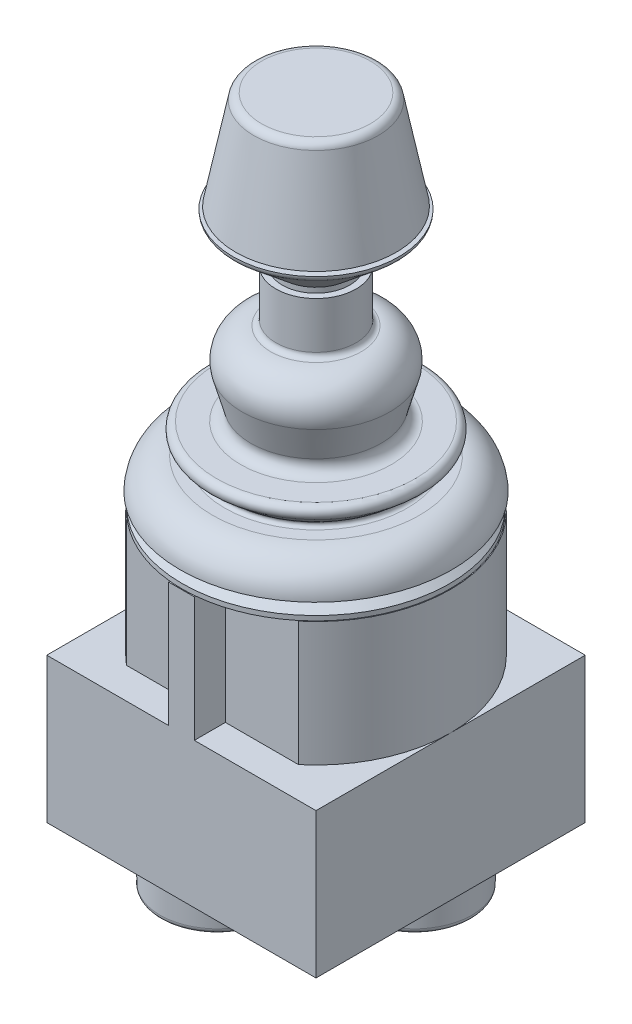
from build123d import *

# Parameters (mm, degrees)
SZKIC2_R                    = 18.5
SZKIC2_R_2                  = 0.95
WYTNIJ_WYCI_GNI_CIE1_DEPTH  = 6.4
SZKIC3_R                    = 1
DODANIE_WYCI_GNI_CIE1_DEPTH = 2
SZKIC4_W                    = 52
SZKIC4_H                    = 52
DODANIE_WYCI_GNI_CIE2_DEPTH = 52
SZKIC5_W                    = 60
SZKIC5_H                    = 60
WYTNIJ_WYCI_GNI_CIE4_DEPTH  = 24
SZKIC6_R                    = 11
DODANIE_WYCI_GNI_CIE3_DEPTH = 11
ZAOKR_GLENIE1_R             = 1


# Read off the part's stored shape, not the designer's step: Skorupa2
with BuildPart() as part:
    # Szkic1 → Obrót1 (revolve)
    with BuildSketch(Plane(origin=(0, 0, 0), x_dir=(0, 0, -1), z_dir=(1, 0, 0)), mode=Mode.PRIVATE) as obr_t1_sk:
        with BuildLine():
            Line((15, 6.4), (22.25, 6.4))
            ThreePointArc((22.25, 6.4), (24.371320344, 5.521320344), (25.25, 3.4))
            Line((25.25, 3.4), (26.25, 3.4))
            ThreePointArc((26.25, 3.4), (24.331930863, 7.657219649), (20, 9.4))
            Line((20, 9.4), (17.621088207, 9.4))
            ThreePointArc((17.621088207, 9.4), (17.036920363, 9.810141552), (17.224274192, 10.498884396))
            Line((17.224274192, 10.498884396), (20.03057159, 12.829539524))
            ThreePointArc((20.03057159, 12.829539524), (20.422721971, 14.271147474), (19.2, 15.129614938))
            Line((19.2, 15.129614938), (14.536076105, 15.129614938))
            ThreePointArc((14.536076105, 15.129614938), (12.913868186, 15.935224719), (12.575371189, 17.714546341))
            Line((12.575371189, 17.714546341), (14.28714728, 23.829614938))
            ThreePointArc((14.28714728, 23.829614938), (13.33121163, 28.854525009), (8.75, 31.129614938))
            ThreePointArc((8.75, 31.129614938), (8.042893219, 31.422508157), (7.75, 32.129614938))
            Line((7.75, 32.129614938), (7.75, 41.129614938))
            Line((7.75, 41.129614938), (6.5, 41.129614938))
            Line((6.5, 41.129614938), (6.5, 42.129614938))
            Line((6.5, 42.129614938), (15.530606989, 49.629614938))
            ThreePointArc((15.530606989, 49.629614938), (15.876814938, 50.077272246), (16, 50.629614938))
            Line((16, 50.629614938), (13, 50.629614938))
            Line((13, 50.629614938), (13, 51.129614938))
            Line((13, 51.129614938), (15.5, 51.129614938))
            Line((15.5, 51.129614938), (12, 68.89628295))
            ThreePointArc((12, 68.89628295), (11.470967017, 69.781692906), (10.5, 70.129614938))
            Line((10.5, 70.129614938), (0, 70.129614938))
            Line((0, 70.129614938), (0, 0))
            Line((0, 0), (25.85, 0))
            Line((25.85, 0), (25.85, 0.9))
            Line((25.85, 0.9), (23, 3.4))
            Line((23, 3.4), (15, 3.4))
            Line((15, 3.4), (15, 6.4))
        make_face()
    revolve(obr_t1_sk.sketch.rotate(Axis((0, 97.609409251, 0), (0, -1, 0)), 180), axis=Axis((0, 97.609409251, 0), (0, -1, 0)))

    # Szkic2 → Wytnij-wyciągnięcie1 (cut)
    with BuildSketch(Plane.XZ):
        with Locations(Location((0, 0, 0), (0, 0, 270))):
            Circle(SZKIC2_R)
        with Locations(Location((-15.25, 15.25, 0), (0, 0, 270))):
            Circle(SZKIC2_R_2)
        with Locations(Location((15.25, 15.25, 0), (0, 0, 270))):
            Circle(SZKIC2_R_2)
        with Locations(Location((-15.25, -15.25, 0), (0, 0, 270))):
            Circle(SZKIC2_R_2)
        with Locations(Location((15.25, -15.25, 0), (0, 0, 270))):
            Circle(SZKIC2_R_2)
    extrude(amount=-WYTNIJ_WYCI_GNI_CIE1_DEPTH, mode=Mode.SUBTRACT)


with BuildPart() as wytnij_wyci_gni_cie1_piece_1:
    # of the separate pieces the step leaves, piece 1, a body of its own (wytnij_wyci_gni_cie1_pieces)
    add(part.part.solids().sort_by_distance((0, 6.4, 22.25))[0])

    # Skorupa2 outline → Skorupa2 (revolve, cut)
    with BuildSketch(Plane.XY):
        with BuildLine():
            ThreePointArc((21.872220162, 6.4), (20.968917996, 6.772847281), (20, 6.9))
            Line((20, 6.9), (17.621088207, 6.9))
            ThreePointArc((17.621088207, 6.9), (14.685531957, 8.96104052), (15.627021134, 12.422106346))
            Line((15.627021134, 12.422106346), (15.876878273, 12.629614938))
            Line((15.876878273, 12.629614938), (14.536076105, 12.629614938))
            ThreePointArc((14.536076105, 12.629614938), (10.922037043, 14.424394253), (10.16791585, 18.388459384))
            Line((10.16791585, 18.388459384), (11.879691941, 24.503527981))
            ThreePointArc((11.879691941, 24.503527981), (11.339380487, 27.343694543), (8.75, 28.629614938))
            ThreePointArc((8.75, 28.629614938), (6.275126266, 29.654741204), (5.25, 32.129614938))
            Line((5.25, 32.129614938), (5.25, 38.629614938))
            Line((5.25, 38.629614938), (4, 38.629614938))
            Line((4, 38.629614938), (4, 43.303097466))
            Line((4, 43.303097466), (10.5, 48.701405692))
            Line((10.5, 48.701405692), (10.5, 53.629614938))
            Line((10.5, 53.629614938), (12.459456142, 53.629614938))
            Line((12.459456142, 53.629614938), (9.701482618, 67.629614938))
            Line((9.701482618, 67.629614938), (0, 67.629614938))
            Line((0, 67.629614938), (0, 6.4))
            Line((0, 6.4), (21.872220162, 6.4))
        make_face()
    revolve(axis=Axis((0, 0, 0), (0, 1, 0)), mode=Mode.SUBTRACT)


with BuildPart() as wytnij_wyci_gni_cie1_piece_2:
    # of the separate pieces the step leaves, piece 2, a body of its own (wytnij_wyci_gni_cie1_pieces)
    add(part.part.solids().sort_by_distance((0, 0, 25.85))[0])

    # Szkic3 → Dodanie-wyciągnięcie1 (add)
    with BuildSketch(Plane.XZ):
        with Locations(Location((-22, 0, 0), (0, 0, 90))):
            Circle(SZKIC3_R)
        with Locations(Location((22, 0, 0), (0, 0, 90))):
            Circle(SZKIC3_R)
    extrude(amount=DODANIE_WYCI_GNI_CIE1_DEPTH)

    # Szkic4 → Dodanie-wyciągnięcie2 (add)
    with BuildSketch(Plane.XZ):
        Rectangle(SZKIC4_W, SZKIC4_H)
    extrude(amount=DODANIE_WYCI_GNI_CIE2_DEPTH)

    # Szkic5 → Wytnij-wyciągnięcie4 (cut)
    with BuildSketch(Plane(origin=(0, 0, 0), x_dir=(1, 0, 0), z_dir=(0, 1, 0))):
        Rectangle(SZKIC5_W, SZKIC5_H)
        with BuildLine():
            Line((-16.613247726, 20), (-2.5, 20))
            Line((-2.5, 20), (-2.5, 26))
            Line((-2.5, 26), (2.5, 26))
            Line((2.5, 26), (2.5, 20))
            Line((2.5, 20), (16.613247726, 20))
            ThreePointArc((16.613247726, 20), (26, 0), (16.613247726, -20))
            Line((16.613247726, -20), (2.5, -20))
            Line((2.5, -20), (2.5, -26))
            Line((2.5, -26), (-2.5, -26))
            Line((-2.5, -26), (-2.5, -20))
            Line((-2.5, -20), (-16.613247726, -20))
            ThreePointArc((-16.613247726, -20), (-26, 0), (-16.613247726, 20))
        make_face(mode=Mode.SUBTRACT)
    extrude(amount=-WYTNIJ_WYCI_GNI_CIE4_DEPTH, mode=Mode.SUBTRACT)

    # Szkic6 → Dodanie-wyciągnięcie3 (add)
    with BuildSketch(Plane.XZ.offset(52)):
        with Locations(Location((-9.545941546, 9.545941546, 0), (0, 0, 90))):
            Circle(SZKIC6_R)
        with Locations(Location((9.545941546, -9.545941546, 0), (0, 0, 90))):
            Circle(SZKIC6_R)
    extrude(amount=DODANIE_WYCI_GNI_CIE3_DEPTH)

    # Zaokrąglenie1
    zaokr_glenie1_edges = [wytnij_wyci_gni_cie1_piece_2.edges().sort_by_distance(p)[0] for p in [
        (-9.545941546, -63, -1.454058454),
        (9.545941546, -63, -20.545941546),
    ]]
    fillet(zaokr_glenie1_edges, radius=ZAOKR_GLENIE1_R)


solid = Compound([wytnij_wyci_gni_cie1_piece_1.part, wytnij_wyci_gni_cie1_piece_2.part])
